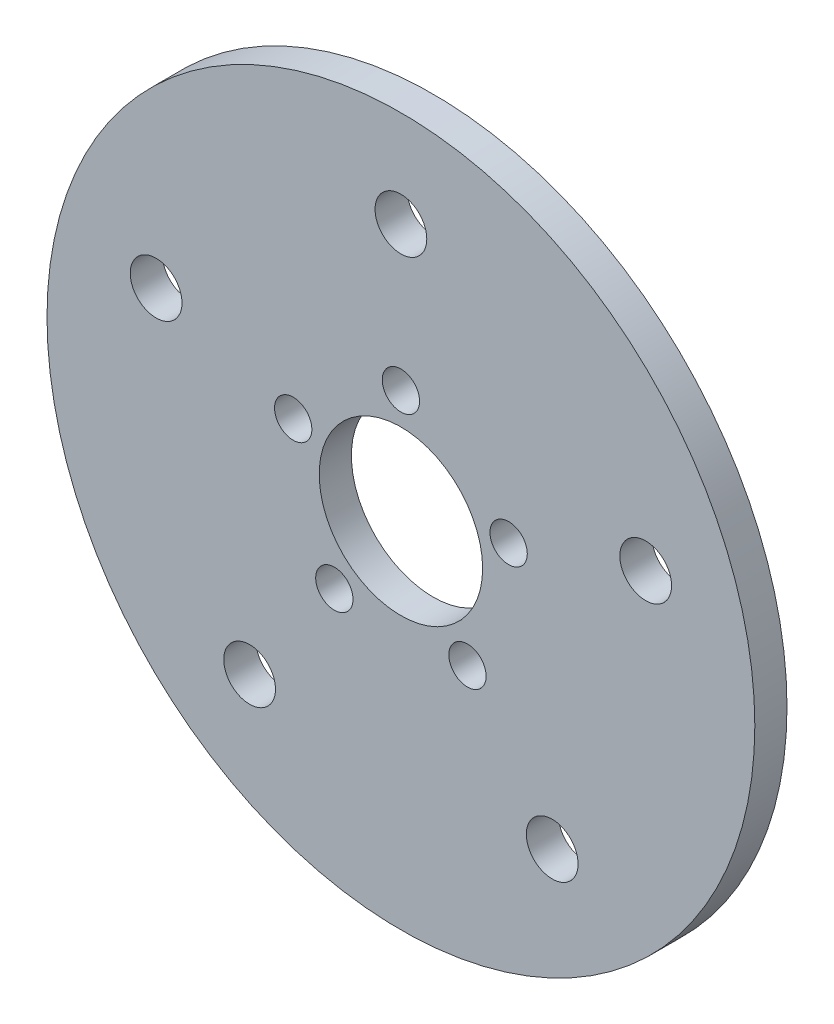
from build123d import *

# Parameters (mm, degrees)
SKETCH1_R           = 34.925
SKETCH1_R_2         = 8.0645
SKETCH1_R_3         = 1.8415
SKETCH1_R_4         = 2.5527
BOSS_EXTRUDE1_DEPTH = 3.175


with BuildPart() as part:
    # Sketch1 → Boss-Extrude1 (new body)
    with BuildSketch(Plane.XY):
        Circle(SKETCH1_R)
        Circle(SKETCH1_R_2, mode=Mode.SUBTRACT)
        with Locations((0, 11.176)):
            Circle(SKETCH1_R_3, mode=Mode.SUBTRACT)
        with Locations((0, 25.4)):
            Circle(SKETCH1_R_4, mode=Mode.SUBTRACT)
        with Locations((10.629007626, 3.453573929)):
            Circle(SKETCH1_R_3, mode=Mode.SUBTRACT)
        with Locations((24.156835514, 7.849031657)):
            Circle(SKETCH1_R_4, mode=Mode.SUBTRACT)
        with Locations((6.56908798, -9.041573929)):
            Circle(SKETCH1_R_3, mode=Mode.SUBTRACT)
        with Locations((14.929745408, -20.549031657)):
            Circle(SKETCH1_R_4, mode=Mode.SUBTRACT)
        with Locations((-6.56908798, -9.041573929)):
            Circle(SKETCH1_R_3, mode=Mode.SUBTRACT)
        with Locations((-14.929745408, -20.549031657)):
            Circle(SKETCH1_R_4, mode=Mode.SUBTRACT)
        with Locations((-10.629007626, 3.453573929)):
            Circle(SKETCH1_R_3, mode=Mode.SUBTRACT)
        with Locations((-24.156835514, 7.849031657)):
            Circle(SKETCH1_R_4, mode=Mode.SUBTRACT)
    extrude(amount=BOSS_EXTRUDE1_DEPTH)


solid = part.part
